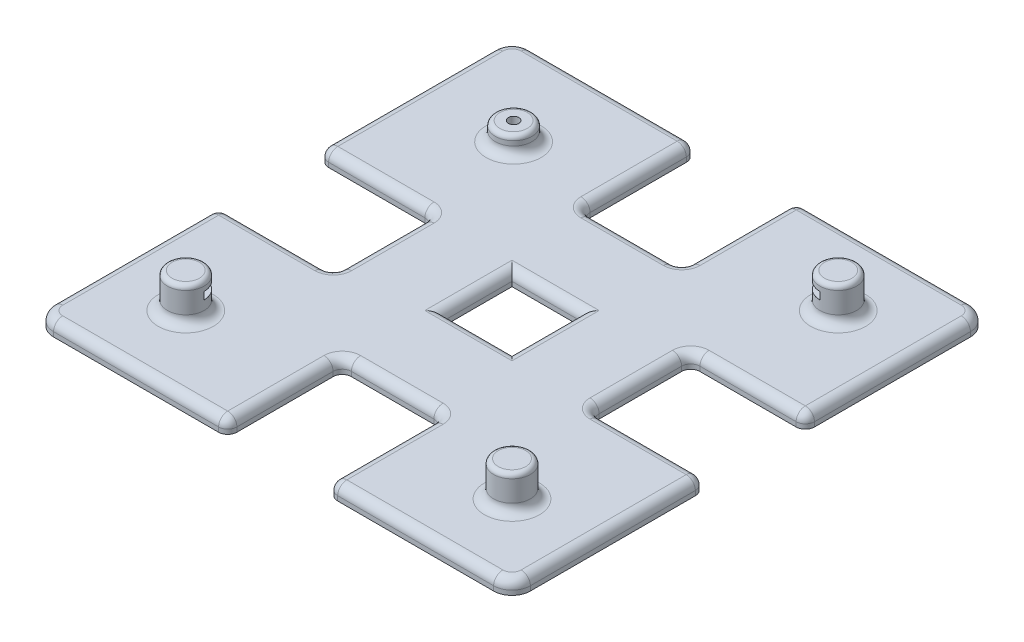
from build123d import *

# Parameters (mm, degrees)
SKETCH1_W           = 103.94
SKETCH1_H           = 103.94
SKETCH1_R           = 1.1303
BOSS_EXTRUDE1_DEPTH = 3
SKETCH6_R           = 4
BOSS_EXTRUDE3_DEPTH = 7.6
SKETCH7_W           = 71.12
SKETCH7_H           = 1.6
CUT_EXTRUDE4_DEPTH  = 35.56
SKETCH2_R           = 4
SKETCH2_R_2         = 1.1303
BOSS_EXTRUDE2_DEPTH = 4
SKETCH3_W           = 20
SKETCH3_H           = 24.97
SKETCH3_W_2         = 24.97
SKETCH3_H_2         = 20
CUT_EXTRUDE1_DEPTH  = 10
SKETCH4_W           = 24.97
SKETCH4_H           = 1.97
SKETCH4_W_2         = 1.97
SKETCH4_H_2         = 24.97
CUT_EXTRUDE2_DEPTH  = 10
SKETCH5_W           = 15
SKETCH5_H           = 15
CUT_EXTRUDE3_DEPTH  = 10
FILLET3_R           = 2
FILLET4_R           = 4
FILLET5_R           = 1
SKETCH8_W           = 4
SKETCH8_H           = 1.6
CUT_EXTRUDE5_DEPTH  = 10


with BuildPart() as part:
    # Sketch1 → Boss-Extrude1 (new body)
    with BuildSketch(Plane(origin=(0, 0, 0), x_dir=(1, 0, 0), z_dir=(0, 1, 0))):
        Rectangle(SKETCH1_W, SKETCH1_H)
        with Locations(Location((-31.7, 32.05, 0), (0, 0, 270))):
            Circle(SKETCH1_R, mode=Mode.SUBTRACT)
    extrude(amount=BOSS_EXTRUDE1_DEPTH)

    # Sketch6 → Boss-Extrude3 (add)
    with BuildSketch(Plane(origin=(0, 3, 0), x_dir=(1, 0, 0), z_dir=(0, 1, 0))):
        with Locations(Location((35.56, 35.56, 0), (0, 0, 90))):
            Circle(SKETCH6_R)
        with Locations(Location((35.56, -35.56, 0), (0, 0, 90))):
            Circle(SKETCH6_R)
        with Locations(Location((-35.56, -35.56, 0), (0, 0, 90))):
            Circle(SKETCH6_R)
    extrude(amount=BOSS_EXTRUDE3_DEPTH)

    # Sketch7 → Cut-Extrude4 (cut, symmetric)
    with BuildSketch(Plane.XY):
        with Locations((0, 7.8)):
            Rectangle(SKETCH7_W, SKETCH7_H)
    extrude(amount=CUT_EXTRUDE4_DEPTH, both=True, mode=Mode.SUBTRACT)

    # Sketch2 → Boss-Extrude2 (add)
    with BuildSketch(Plane(origin=(0, 3, 0), x_dir=(1, 0, 0), z_dir=(0, 1, 0))):
        with Locations(Location((-31.7, 32.05, 0), (0, 0, 270))):
            Circle(SKETCH2_R)
        with Locations(Location((-31.7, 32.05, 0), (0, 0, 270))):
            Circle(SKETCH2_R_2, mode=Mode.SUBTRACT)
    extrude(amount=BOSS_EXTRUDE2_DEPTH)

    # Sketch3 → Cut-Extrude1 (cut)
    with BuildSketch(Plane(origin=(0, 3, 0), x_dir=(1, 0, 0), z_dir=(0, 1, 0))):
        with Locations((0, 39.485)):
            Rectangle(SKETCH3_W, SKETCH3_H)
        with Locations((0, -39.485)):
            Rectangle(SKETCH3_W, SKETCH3_H)
        with Locations((-39.485, 0)):
            Rectangle(SKETCH3_W_2, SKETCH3_H_2)
        with Locations((39.485, 0)):
            Rectangle(SKETCH3_W_2, SKETCH3_H_2)
    extrude(amount=-CUT_EXTRUDE1_DEPTH, mode=Mode.SUBTRACT)

    # Sketch4 → Cut-Extrude2 (cut)
    with BuildSketch(Plane(origin=(0, 3, 0), x_dir=(1, 0, 0), z_dir=(0, 1, 0))):
        with Locations((-39.485, -10.985)):
            Rectangle(SKETCH4_W, SKETCH4_H)
        with Locations((10.985, -39.485)):
            Rectangle(SKETCH4_W_2, SKETCH4_H_2)
        with Locations((39.485, 10.985)):
            Rectangle(SKETCH4_W, SKETCH4_H)
        with Locations((-10.985, 39.485)):
            Rectangle(SKETCH4_W_2, SKETCH4_H_2)
    extrude(amount=-CUT_EXTRUDE2_DEPTH, mode=Mode.SUBTRACT)

    # Sketch5 → Cut-Extrude3 (cut)
    with BuildSketch(Plane(origin=(0, 3, 0), x_dir=(1, 0, 0), z_dir=(0, 1, 0))):
        Rectangle(SKETCH5_W, SKETCH5_H)
    extrude(amount=-CUT_EXTRUDE3_DEPTH, mode=Mode.SUBTRACT)

    # Fillet3
    fillet3_edges = [part.edges().sort_by_distance(p)[0] for p in [
        (-51.97, 3, -30.985),
        (51.97, 1.5, 10),
        (27, 1.5, 10),
        (27, 3, -0.985),
        (39.485, 3, 10),
        (-51.97, 1.5, -10),
        (-27, 1.5, -10),
        (-39.485, 3, -10),
        (-27, 3, 0.985),
        (-30.985, 3, 51.97),
        (-51.97, 3, 31.97),
        (-27, 1.5, 11.97),
        (-51.97, 1.5, 11.97),
        (-39.485, 3, 11.97),
        (31.97, 3, 51.97),
        (11.97, 1.5, 27),
        (11.97, 1.5, 51.97),
        (11.97, 3, 39.485),
        (51.97, 3, -31.97),
        (27, 1.5, -11.97),
        (51.97, 1.5, -11.97),
        (35.56, 3, -31.56),
        (39.485, 3, -11.97),
        (-31.97, 3, -51.97),
        (-11.97, 1.5, -27),
        (-11.97, 1.5, -51.97),
        (-11.97, 3, -39.485),
        (35.56, 3, 39.56),
        (-7.5, 3, 0),
        (0, 3, 7.5),
        (7.5, 3, 0),
        (0, 3, -7.5),
        (-35.56, 3, 39.56),
        (51.97, 3, 30.985),
        (-31.7, 3, -36.05),
        (10, 1.5, -51.97),
        (30.985, 3, -51.97),
        (10, 1.5, -27),
        (-0.985, 3, -27),
        (10, 3, -39.485),
        (-10, 1.5, 51.97),
        (-10, 1.5, 27),
        (0.985, 3, 27),
        (-10, 3, 39.485),
    ]]
    fillet(fillet3_edges, radius=FILLET3_R)

    # Fillet4
    # the kernel refuses this fillet: 4 mm, written as the material it takes off along each edge
    with BuildSketch(Plane(origin=(-47.97, 3, 47.97), x_dir=(-1, 0, 0), z_dir=(0, 0, -1))) as fillet4_piece_1:
        with BuildLine():
            CenterArc((2, -2), 2, 0, 90)
            Line((4, -2), (4, 0))
            Line((4, 0), (2, 0))
        make_face()
    revolve(axis=Axis((-47.97, 3, 47.97), (0, 1, 0)), revolution_arc=90, mode=Mode.SUBTRACT)
    with BuildSketch(Plane(origin=(47.97, 3, 47.97), x_dir=(0, 0, 1), z_dir=(-1, 0, 0))) as fillet4_piece_2:
        with BuildLine():
            CenterArc((2, -2), 2, 0, 90)
            Line((4, -2), (4, 0))
            Line((4, 0), (2, 0))
        make_face()
    revolve(axis=Axis((47.97, 3, 47.97), (0, 1, 0)), revolution_arc=90, mode=Mode.SUBTRACT)
    with BuildSketch(Plane(origin=(-47.97, 3, -47.97), x_dir=(0, 0, -1), z_dir=(1, 0, 0))) as fillet4_piece_3:
        with BuildLine():
            CenterArc((2, -2), 2, 0, 90)
            Line((4, -2), (4, 0))
            Line((4, 0), (2, 0))
        make_face()
    revolve(axis=Axis((-47.97, 3, -47.97), (0, 1, 0)), revolution_arc=90, mode=Mode.SUBTRACT)
    with BuildSketch(Plane(origin=(47.97, 3, -47.97), x_dir=(1, 0, 0), z_dir=(0, 0, 1))) as fillet4_piece_4:
        with BuildLine():
            CenterArc((2, -2), 2, 0, 90)
            Line((4, -2), (4, 0))
            Line((4, 0), (2, 0))
        make_face()
    revolve(axis=Axis((47.97, 3, -47.97), (0, 1, 0)), revolution_arc=90, mode=Mode.SUBTRACT)
    with BuildSketch(Plane(origin=(51.97, -10, -51.97), x_dir=(-1, 0, 0), z_dir=(0, 1, 0))) as fillet4_piece_5:
        with BuildLine():
            CenterArc((FILLET4_R, FILLET4_R), FILLET4_R, 180, 90)
            Line((0, FILLET4_R), (0, 0))
            Line((0, 0), (FILLET4_R, 0))
        make_face()
    extrude(amount=13, mode=Mode.SUBTRACT)
    with BuildSketch(Plane(origin=(51.97, -10, 51.97), x_dir=(-1, 0, 0), z_dir=(0, 1, 0)), Plane(origin=(-51.97, -10, 51.97), x_dir=(0, 0, -1), z_dir=(0, 1, 0)), Plane(origin=(-51.97, -10, -51.97), x_dir=(1, 0, 0), z_dir=(0, 1, 0))) as fillet4_piece_6:
        with BuildLine():
            CenterArc((FILLET4_R, -FILLET4_R), FILLET4_R, 90, 90)
            Line((0, -FILLET4_R), (0, 0))
            Line((0, 0), (FILLET4_R, 0))
        make_face()
    extrude(amount=13, mode=Mode.SUBTRACT)

    # Fillet5
    fillet5_edges = [part.edges().sort_by_distance(p)[0] for p in [
        (35.56, 10.6, -31.56),
        (35.56, 10.6, 39.56),
        (-35.56, 10.6, 39.56),
        (-31.7, 7, -36.05),
    ]]
    fillet(fillet5_edges, radius=FILLET5_R)

    # Sketch8 → Cut-Extrude5 (cut)
    with BuildSketch(Plane.XY.offset(-35.56)):
        with Locations((33.56, 7.8)):
            Rectangle(SKETCH8_W, SKETCH8_H)
    extrude(amount=-CUT_EXTRUDE5_DEPTH, mode=Mode.SUBTRACT)


solid = part.part
